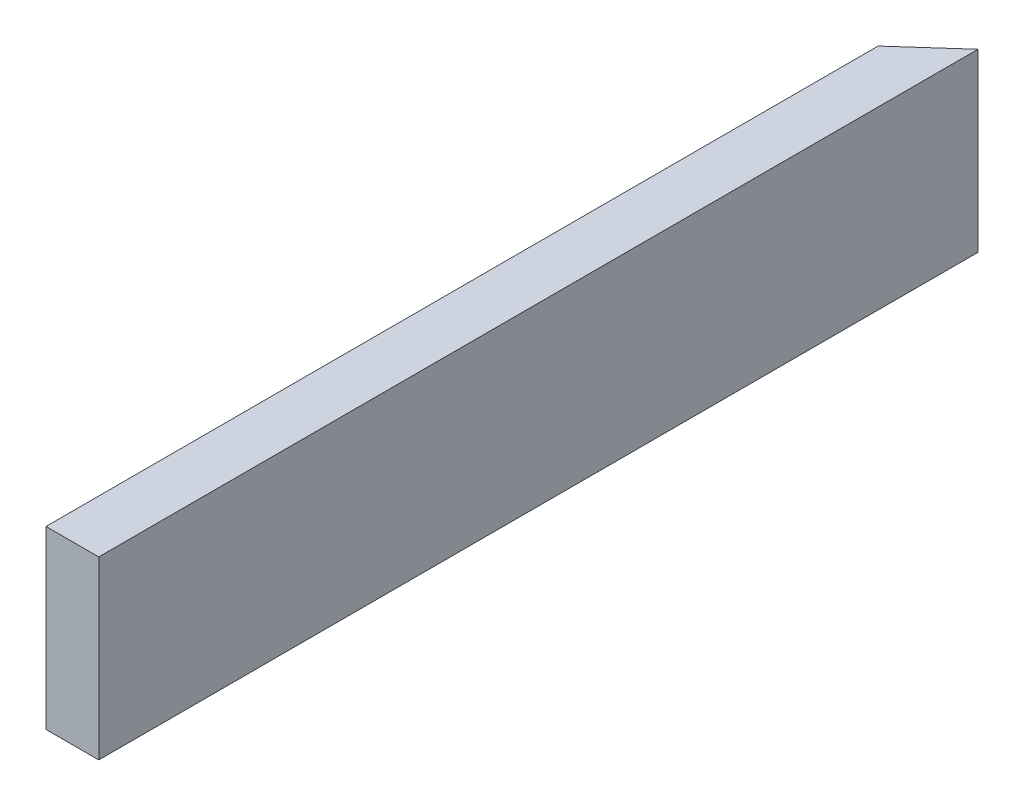
from build123d import *

# Parameters (mm, degrees)
SKETCH1_W           = 3
SKETCH1_H           = 10
BOSS_EXTRUDE1_DEPTH = 50
CUT_EXTRUDE1_DEPTH  = 52


with BuildPart() as part:
    # Sketch1 → Boss-Extrude1 (new body)
    with BuildSketch(Plane.XY):
        with Locations((-2.403225806, 7.838709677)):
            Rectangle(SKETCH1_W, SKETCH1_H)
    extrude(amount=BOSS_EXTRUDE1_DEPTH)

    # Sketch3 → Cut-Extrude1 (cut)
    with BuildSketch(Plane(origin=(0, 12.838709677, 0), x_dir=(1, 0, 0), z_dir=(0, 1, 0))):
        Polygon((-0.903225806, 0), (-3.903225806, -2.682309573), (-3.903225806, 0), align=None)
    extrude(amount=-CUT_EXTRUDE1_DEPTH, mode=Mode.SUBTRACT)


solid = part.part
